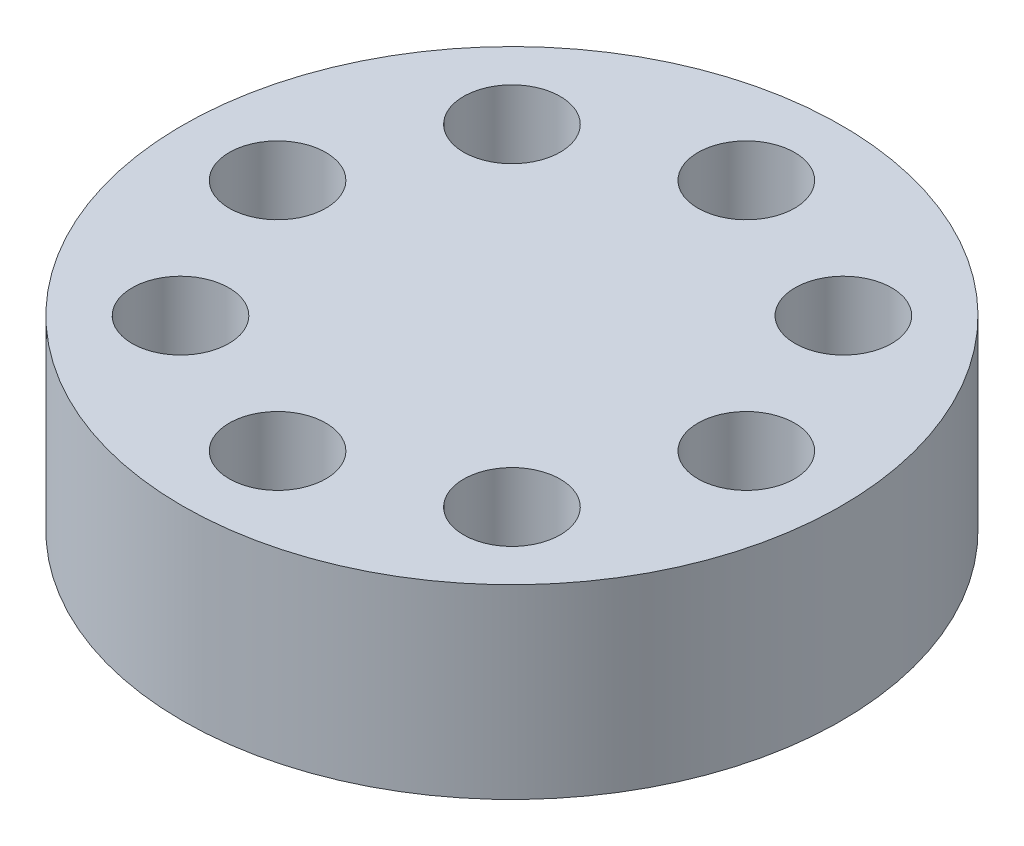
from build123d import *

# Parameters (mm, degrees)
SKETCH1_R           = 22.5
BOSS_EXTRUDE1_DEPTH = 12.7
SKETCH2_R           = 3.3
CUT_EXTRUDE1_DEPTH  = 35.260618792


with BuildPart() as part:
    # Sketch1 → Boss-Extrude1 (new body)
    with BuildSketch(Plane(origin=(0, 0, 0), x_dir=(1, 0, 0), z_dir=(0, 1, 0))):
        Circle(SKETCH1_R)
    extrude(amount=BOSS_EXTRUDE1_DEPTH)

    # Sketch2 → Cut-Extrude1 (cut, through all)
    with BuildSketch(Plane(origin=(0, 12.7, 0), x_dir=(1, 0, 0), z_dir=(0, 1, 0))):
        with Locations((-16, 0)):
            Circle(SKETCH2_R)
        with Locations((-11.313708499, 11.313708499)):
            Circle(SKETCH2_R)
        with Locations((0, 16)):
            Circle(SKETCH2_R)
        with Locations((11.313708499, 11.313708499)):
            Circle(SKETCH2_R)
        with Locations((16, 0)):
            Circle(SKETCH2_R)
        with Locations((11.313708499, -11.313708499)):
            Circle(SKETCH2_R)
        with Locations((0, -16)):
            Circle(SKETCH2_R)
        with Locations((-11.313708499, -11.313708499)):
            Circle(SKETCH2_R)
    extrude(amount=-CUT_EXTRUDE1_DEPTH, mode=Mode.SUBTRACT)


solid = part.part
